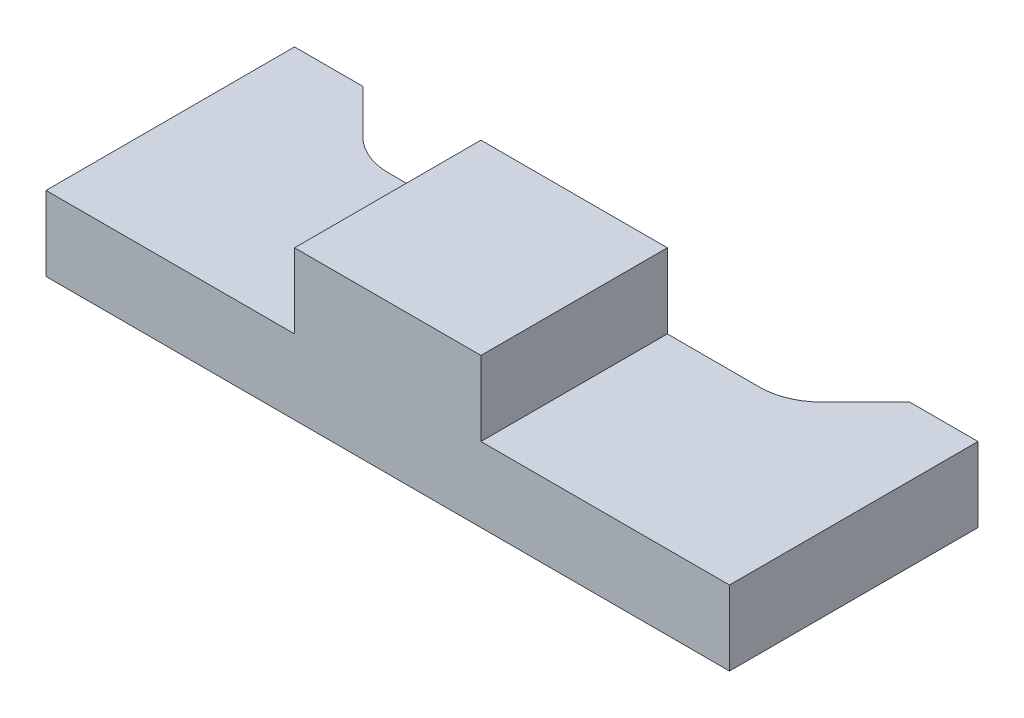
from build123d import *

# Parameters (mm, degrees)
BOSS_EXTRUDE2_DEPTH         = 20
TAP_DRILL_FOR_M6_TAP2_D     = 5
TAP_DRILL_FOR_M6_TAP2_DEPTH = 8
TAP_DRILL_FOR_M6_TAP2_TIP   = 1.502151548
CUT_EXTRUDE1_REACH          = 38.059
FILLET1_R                   = 5


with BuildPart() as part:
    # Sketch4 → Boss-Extrude2 (new body)
    with BuildSketch(Plane.XY):
        Polygon((-27.5, 0), (27.5, 0), (27.5, 6), (7.5, 6), (7.5, 12), (-7.5, 12), (-7.5, 6), (-27.5, 6), align=None)
    extrude(amount=BOSS_EXTRUDE2_DEPTH)

    # Tap Drill for M6 Tap2
    with Locations(Plane(origin=(0, 0, 0), x_dir=(-1, 0, 0), z_dir=(0, 0, -1))):
        with Locations((0, 6)):
            Hole(TAP_DRILL_FOR_M6_TAP2_D / 2, depth=TAP_DRILL_FOR_M6_TAP2_DEPTH)
            with Locations((0, 0, -(TAP_DRILL_FOR_M6_TAP2_DEPTH + TAP_DRILL_FOR_M6_TAP2_TIP / 2))):  # 118° drill point
                Cone(0, TAP_DRILL_FOR_M6_TAP2_D / 2, TAP_DRILL_FOR_M6_TAP2_TIP, mode=Mode.SUBTRACT)

    # Sketch7 → Cut-Extrude1 (cut, up to next)
    with BuildSketch(Plane(origin=(0, 12, 0), x_dir=(1, 0, 0), z_dir=(0, 1, 0)), mode=Mode.PRIVATE) as cut_extrude1_sk1:
        Polygon((-22, 0), (22, 0), (17, -5), (-17, -5), align=None)
    cut_extrude1_tool1 = extrude(cut_extrude1_sk1.sketch, amount=-CUT_EXTRUDE1_REACH, mode=Mode.PRIVATE) & part.part
    add(cut_extrude1_tool1.solids().sort_by_distance((0, 12, 2.393162))[0], mode=Mode.SUBTRACT)

    # Fillet1
    fillet1_edges = [part.edges().sort_by_distance(p)[0] for p in [
        (-17, 3, 5),
        (17, 3, 5),
    ]]
    fillet(fillet1_edges, radius=FILLET1_R)


solid = part.part
